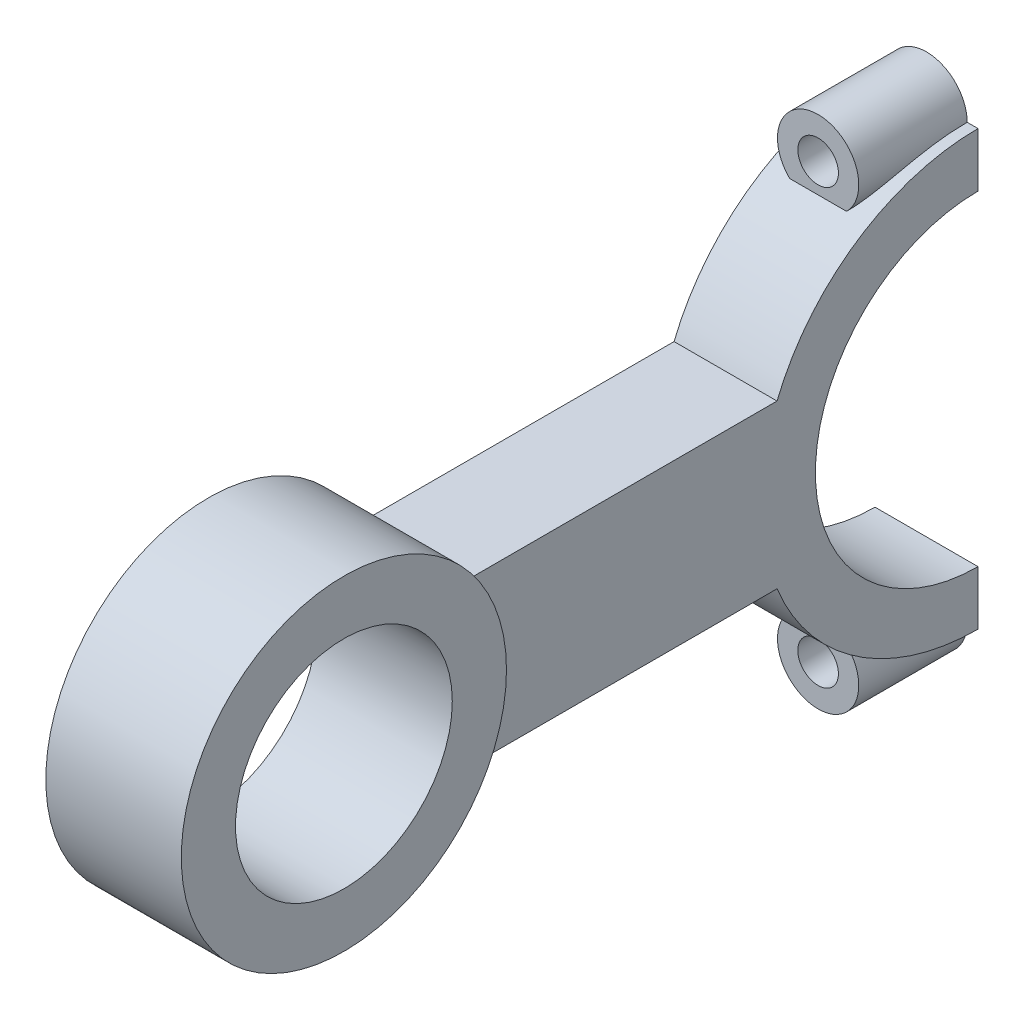
from build123d import *

# Parameters (mm, degrees)
SKETCH1_R           = 25.4
BOSS_EXTRUDE2_DEPTH = 12.065
SKETCH1_6_R         = 38.1
SKETCH1_6_R_2       = 25.4
BOSS_EXTRUDE3_DEPTH = 15.875
SKETCH3_R           = 9.525
BOSS_EXTRUDE4_DEPTH = 25.4
SKETCH5_R           = 4.76
CUT_EXTRUDE1_DEPTH  = 32.4


with BuildPart() as part:
    # Sketch1 → Boss-Extrude2 (new, symmetric)
    with BuildSketch(Plane(origin=(0, 0, 0), x_dir=(0, 0, -1), z_dir=(1, 0, 0))):
        with BuildLine():
            ThreePointArc((76.2, -38.1), (38.1, 0), (76.2, 38.1))
            Line((76.2, 38.1), (76.2, 50.8))
            ThreePointArc((76.2, 50.8), (47.801936686, 42.121134838), (29.107139607, 19.05))
            Line((29.107139607, 19.05), (-43.204432116, 19.05))
            ThreePointArc((-43.204432116, 19.05), (-114.3, 0), (-43.204432116, -19.05))
            Line((-43.204432116, -19.05), (29.107139607, -19.05))
            ThreePointArc((29.107139607, -19.05), (47.801936686, -42.121134838), (76.2, -50.8))
            Line((76.2, -50.8), (76.2, -38.1))
        make_face()
        with Locations((-76.2, 0)):
            Circle(SKETCH1_R, mode=Mode.SUBTRACT)
    extrude(amount=BOSS_EXTRUDE2_DEPTH, both=True)

    # Sketch1<6> → Boss-Extrude3 (add, symmetric)
    with BuildSketch(Plane(origin=(0, 0, 0), x_dir=(0, 0, -1), z_dir=(1, 0, 0))):
        with Locations((-76.2, 0)):
            Circle(SKETCH1_6_R)
        with Locations((-76.2, 0)):
            Circle(SKETCH1_6_R_2, mode=Mode.SUBTRACT)
    extrude(amount=BOSS_EXTRUDE3_DEPTH, both=True)

    # Sketch3 → Boss-Extrude4 (add)
    with BuildSketch(Plane(origin=(0, 0, -76.2), x_dir=(-1, 0, 0), z_dir=(0, 0, -1))):
        with Locations((0, -50.8)):
            Circle(SKETCH3_R)
    boss_extrude4 = extrude(amount=-BOSS_EXTRUDE4_DEPTH)

    # Sketch5 → Cut-Extrude1 (cut)
    with BuildSketch(Plane(origin=(0, 0, -76.2), x_dir=(-1, 0, 0), z_dir=(0, 0, -1))):
        with Locations((0, -50.8)):
            Circle(SKETCH5_R)
    cut_extrude1 = extrude(amount=-CUT_EXTRUDE1_DEPTH, mode=Mode.SUBTRACT)

    # Mirror2: Boss-Extrude4, Cut-Extrude1 across plane
    add(boss_extrude4.mirror(Plane.ZX))
    add(cut_extrude1.mirror(Plane.ZX), mode=Mode.SUBTRACT)


solid = part.part
